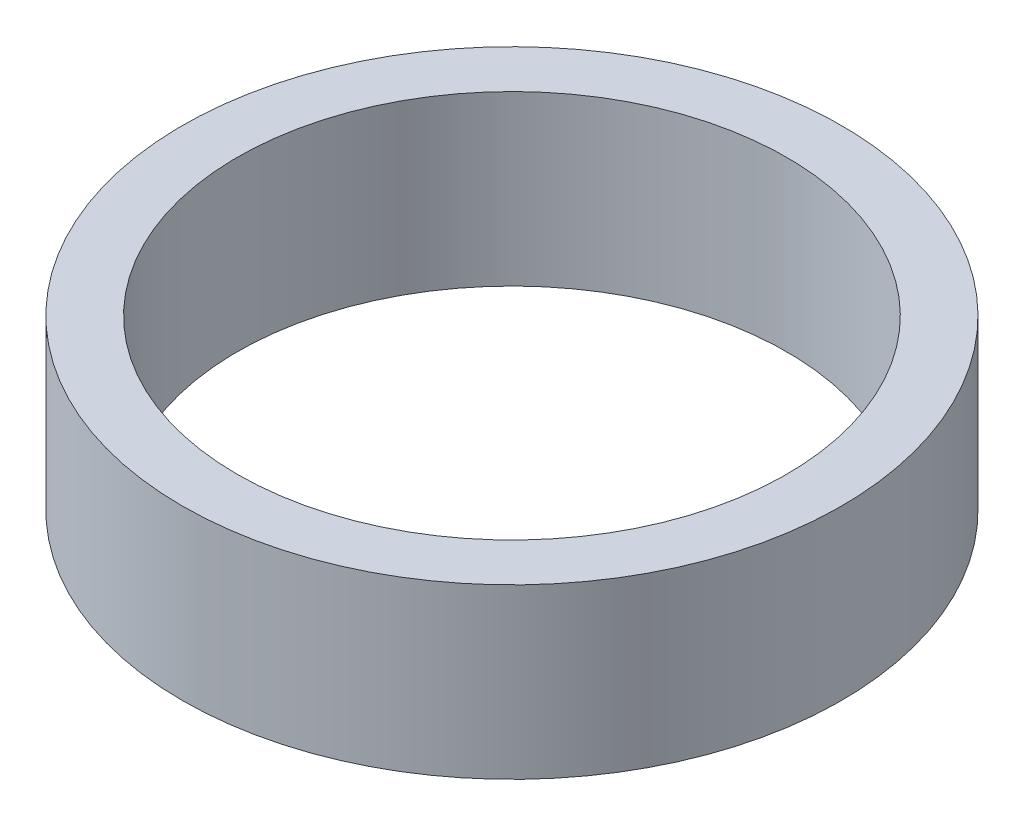
from build123d import *

# Parameters (mm, degrees)
SKETCH1_R           = 45
BOSS_EXTRUDE1_DEPTH = 23
SKETCH2_R           = 37.5
CUT_EXTRUDE1_DEPTH  = 68.668308683


with BuildPart() as part:
    # Sketch1 → Boss-Extrude1 (new body)
    with BuildSketch(Plane(origin=(0, 0, 0), x_dir=(1, 0, 0), z_dir=(0, 1, 0))):
        Circle(SKETCH1_R)
    extrude(amount=BOSS_EXTRUDE1_DEPTH)

    # Sketch2 → Cut-Extrude1 (cut, through all)
    with BuildSketch(Plane(origin=(0, 0, 0), x_dir=(1, 0, 0), z_dir=(0, 1, 0))):
        Circle(SKETCH2_R)
    extrude(amount=CUT_EXTRUDE1_DEPTH, mode=Mode.SUBTRACT)


solid = part.part
